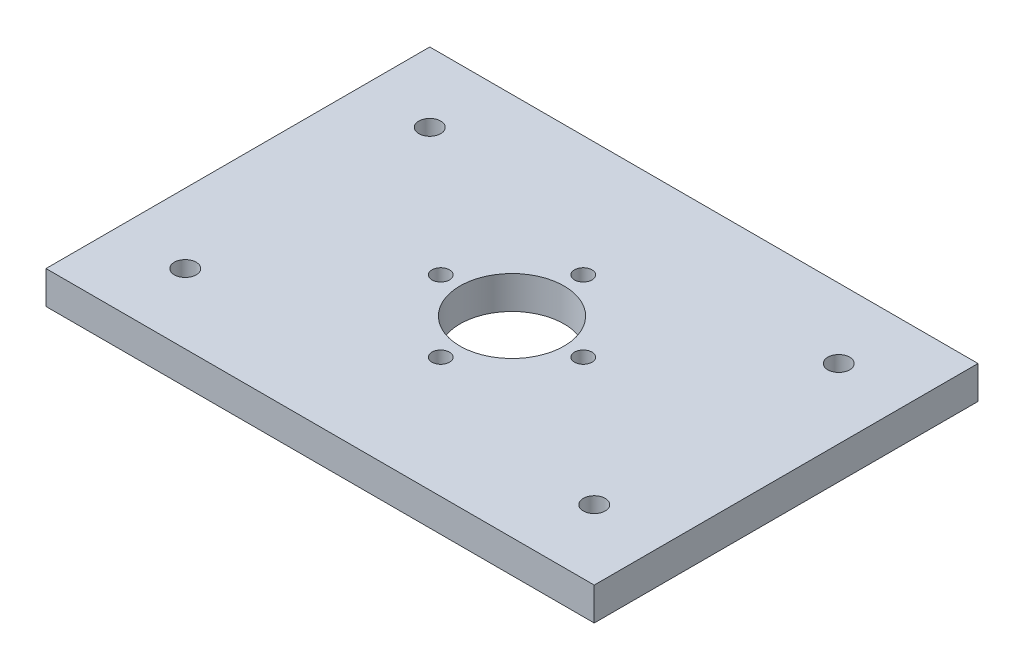
from build123d import *

# Parameters (mm, degrees)
SKETCH1_W                                       = 100
SKETCH1_H                                       = 70
SKETCH1_R                                       = 9.5
SKETCH1_R_2                                     = 2
BOSS_EXTRUDE1_DEPTH                             = 6
CSK_FOR_M3_FLAT_HEAD_MACHINE_SCREW1_D           = 3.2
CSK_FOR_M3_FLAT_HEAD_MACHINE_SCREW1_CSINK_D     = 6.3
CSK_FOR_M3_FLAT_HEAD_MACHINE_SCREW1_CSINK_ANGLE = 90


with BuildPart() as part:
    # Sketch1 → Boss-Extrude1 (new body)
    with BuildSketch(Plane(origin=(0, 0, 0), x_dir=(1, 0, 0), z_dir=(0, 1, 0))):
        Rectangle(SKETCH1_W, SKETCH1_H)
        Circle(SKETCH1_R, mode=Mode.SUBTRACT)
        with Locations((-37.3, 22.3)):
            Circle(SKETCH1_R_2, mode=Mode.SUBTRACT)
        with Locations((37.3, 22.3)):
            Circle(SKETCH1_R_2, mode=Mode.SUBTRACT)
        with Locations((37.3, -22.3)):
            Circle(SKETCH1_R_2, mode=Mode.SUBTRACT)
        with Locations((-37.3, -22.3)):
            Circle(SKETCH1_R_2, mode=Mode.SUBTRACT)
    extrude(amount=BOSS_EXTRUDE1_DEPTH)

    # CSK for M3 Flat Head Machine Screw1 (through all)
    with Locations(Plane(origin=(0, 0, 0), x_dir=(-1, 0, 0), z_dir=(0, -1, 0))):
        with Locations((-13, 0), (0, -13), (13, 0), (0, 13)):
            CounterSinkHole(CSK_FOR_M3_FLAT_HEAD_MACHINE_SCREW1_D / 2, CSK_FOR_M3_FLAT_HEAD_MACHINE_SCREW1_CSINK_D / 2, counter_sink_angle=CSK_FOR_M3_FLAT_HEAD_MACHINE_SCREW1_CSINK_ANGLE)


solid = part.part
